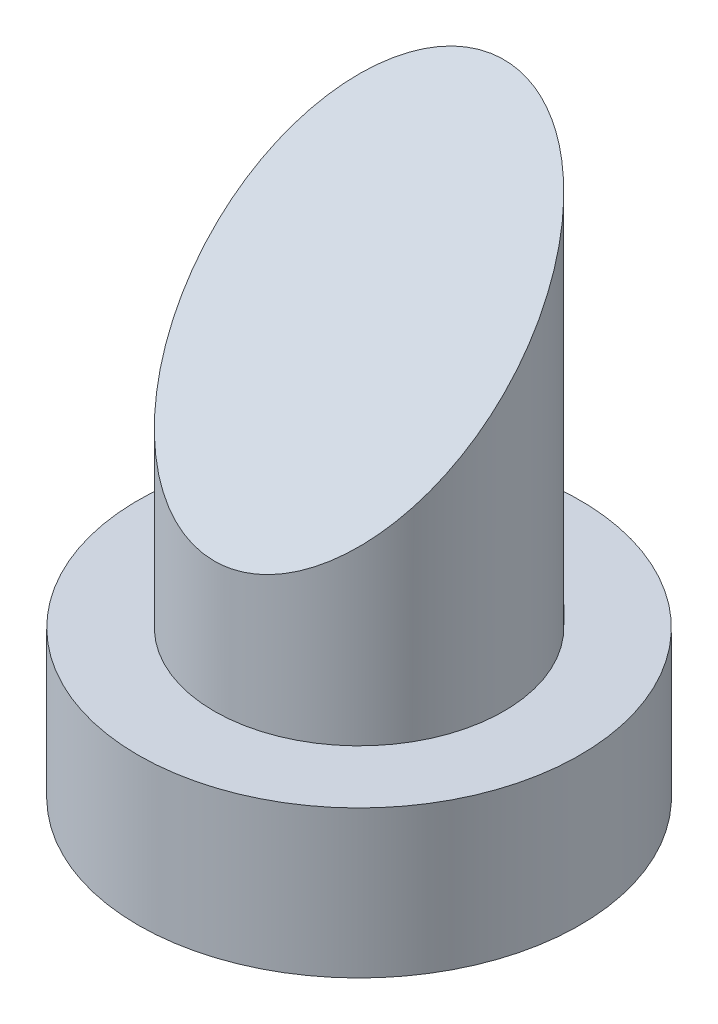
from build123d import *

# Parameters (mm, degrees)
SKETCH1_R               = 9
BOSS_EXTRUDE1_DEPTH     = 6
SKETCH2_R               = 5.9
BOSS_EXTRUDE2_DEPTH     = 20
CUT_EXTRUDE1_DEPTH      = 29.948229652
CUT_EXTRUDE1_DEPTH_BACK = 29.948229652
SKETCH4_R               = 0.5
CUT_EXTRUDE2_DEPTH      = 1.5


with BuildPart() as part:
    # Sketch1 → Boss-Extrude1 (new body)
    with BuildSketch(Plane(origin=(0, 0, 0), x_dir=(1, 0, 0), z_dir=(0, 1, 0))):
        Circle(SKETCH1_R)
    extrude(amount=BOSS_EXTRUDE1_DEPTH)

    # Sketch2 → Boss-Extrude2 (add)
    with BuildSketch(Plane(origin=(0, 6, 0), x_dir=(1, 0, 0), z_dir=(0, 1, 0))):
        Circle(SKETCH2_R)
    extrude(amount=BOSS_EXTRUDE2_DEPTH)

    # Sketch3 → Cut-Extrude1 (cut, two sides: drawn at the far end of the back side and taken through both)
    with BuildSketch(Plane(origin=(0, 0, 0), x_dir=(0, 0, -1), z_dir=(1, 0, 0)).offset(-CUT_EXTRUDE1_DEPTH_BACK)):
        Polygon((-6.28, 28.771900514), (-6.28, 10.92), (6.28, 23.48), (6.28, 28.771900514), align=None)
    extrude(amount=CUT_EXTRUDE1_DEPTH + CUT_EXTRUDE1_DEPTH_BACK, mode=Mode.SUBTRACT)

    # Sketch4 → Cut-Extrude2 (cut)
    with BuildSketch(Plane.XZ):
        with Locations((0, -6)):
            Circle(SKETCH4_R)
    extrude(amount=-CUT_EXTRUDE2_DEPTH, mode=Mode.SUBTRACT)


solid = part.part
